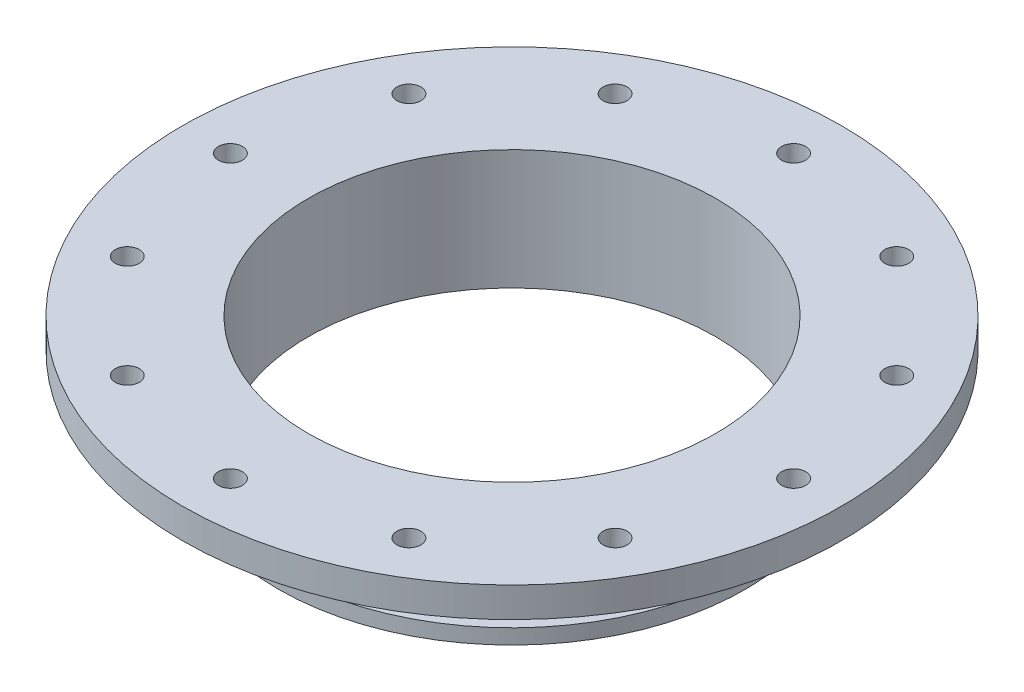
from build123d import *

# Parameters (mm, degrees)
SKETCH1_W           = 26.67
SKETCH1_H           = 6.35
BOSS_EXTRUDE1_START = 19.05
SKETCH2_R           = 49.53
SKETCH2_R_2         = 43.18
BOSS_EXTRUDE1_DEPTH = 19.05
SKETCH3_W           = 3.175
SKETCH3_H           = 2.116666667
SKETCH3_H_2         = 2.116666666
SKETCH4_R           = 2.54
CUT_EXTRUDE1_DEPTH  = 102.996102867
CIRPATTERN1_COUNT   = 12


with BuildPart() as part:
    # Sketch1 → Revolve1 (revolve)
    with BuildSketch(Plane.XY):
        with Locations((56.515, -3.175)):
            Rectangle(SKETCH1_W, SKETCH1_H)
    revolve(axis=Axis((0, -127, 0), (0, 1, 0)))

    # Sketch2 → Boss-Extrude1 (add)
    with BuildSketch(Plane.XZ.offset(6.35).offset(BOSS_EXTRUDE1_START)):
        Circle(SKETCH2_R)
        Circle(SKETCH2_R_2, mode=Mode.SUBTRACT)
    extrude(amount=-BOSS_EXTRUDE1_DEPTH)

    # Sketch3 → Cut-Revolve1 (revolve, cut)
    with BuildSketch(Plane.XY):
        with Locations((47.9425, -10.583333334)):
            Rectangle(SKETCH3_W, SKETCH3_H)
        with Locations((47.9425, -15.875)):
            Rectangle(SKETCH3_W, SKETCH3_H_2)
        with Locations((47.9425, -21.166666666)):
            Rectangle(SKETCH3_W, SKETCH3_H)
    revolve(axis=Axis((0, 0, 0), (0, -1, 0)), mode=Mode.SUBTRACT)

    # Sketch4 → Cut-Extrude1 (cut, through all)
    with BuildSketch(Plane(origin=(0, 0, 0), x_dir=(1, 0, 0), z_dir=(0, 1, 0))):
        with Locations((-59.69, 0)):
            Circle(SKETCH4_R)
    cut_extrude1 = extrude(amount=-CUT_EXTRUDE1_DEPTH, mode=Mode.SUBTRACT)

    # CirPattern1: Cut-Extrude1 ×12 about axis
    cirpattern1_axis = Axis((0, 0, 0), (0, -1, 0))
    for i in range(1, CIRPATTERN1_COUNT):
        add(cut_extrude1.rotate(cirpattern1_axis, i * 360 / CIRPATTERN1_COUNT), mode=Mode.SUBTRACT)


solid = part.part
